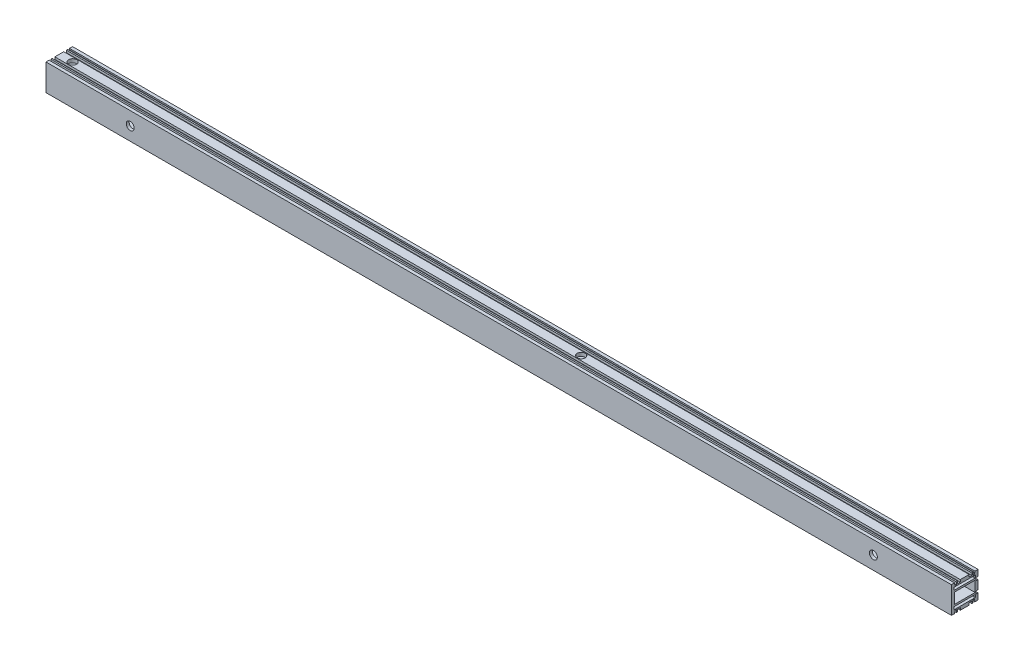
from build123d import *

# Parameters (mm, degrees)
SKETCH_1_W             = 23.5
SKETCH_1_H             = 12
EXTRUDE_1_DEPTH        = 510.5
HOLE_WIZARD_M6_1_D     = 5
HOLE_WIZARD_M6_1_DEPTH = 19
HOLE_WIZARD_M6_1_TIP   = 1.502151548
HOLE_WIZARD_M6_2_D     = 5
HOLE_WIZARD_M6_2_DEPTH = 19
HOLE_WIZARD_M6_2_TIP   = 1.502151548
SKETCH_6_R             = 4.5
CUT_EXTRUDE_1_DEPTH    = 512.600674355
SKETCH_7_R             = 4.5
CUT_EXTRUDE_2_DEPTH    = 512.600674355
HOLE_WIZARD_M4_1_D     = 3.3
HOLE_WIZARD_M4_1_DEPTH = 11.5
HOLE_WIZARD_M4_1_TIP   = 0.991420021


with BuildPart() as part:
    # 草图1 → 凸台-拉伸1 (new, symmetric)
    with BuildSketch(Plane(origin=(0, 0, 0), x_dir=(0, 0, -1), z_dir=(1, 0, 0))):
        Polygon((-11.5, 15), (-15, 15), (-15, -15), (-11.5, -15), (-11.5, -13.5), (-11, -13.5), (-11, -12), (-9.5, -12), (-9.5, -15), (-8, -15), (-8, -12.5), (-5, -12.5), (-5, -15), (5, -15), (5, -12.5), (8, -12.5), (8, -15), (9.5, -15), (9.5, -12), (11, -12), (11, -13.5), (11.5, -13.5), (11.5, -15), (15, -15), (15, -8), (12.5, -8), (12.5, -5), (15, -5), (15, 5), (12.5, 5), (12.5, 8), (15, 8), (15, 15), (11.5, 15), (11.5, 13.5), (11, 13.5), (11, 12), (9.5, 12), (9.5, 15), (8, 15), (8, 12.5), (5, 12.5), (5, 15), (-5, 15), (-5, 12.5), (-8, 12.5), (-8, 15), (-9.5, 15), (-9.5, 12), (-11, 12), (-11, 13.5), (-11.5, 13.5), align=None)
        with BuildLine():
            Line((12, -8.5), (12, -10.5))
            ThreePointArc((12, -10.5), (11.853553391, -10.853553391), (11.5, -11))
            Line((11.5, -11), (-11.5, -11))
            ThreePointArc((-11.5, -11), (-11.853553391, -10.853553391), (-12, -10.5))
            Line((-12, -10.5), (-12, -8.5))
            ThreePointArc((-12, -8.5), (-11.853553391, -8.146446609), (-11.5, -8))
            Line((-11.5, -8), (11.5, -8))
            ThreePointArc((11.5, -8), (11.853553391, -8.146446609), (12, -8.5))
        make_face(mode=Mode.SUBTRACT)
        Rectangle(SKETCH_1_W, SKETCH_1_H, mode=Mode.SUBTRACT)
        with BuildLine():
            ThreePointArc((-12, 10.5), (-11.853553391, 10.853553391), (-11.5, 11))
            Line((-11.5, 11), (11.5, 11))
            ThreePointArc((11.5, 11), (11.853553391, 10.853553391), (12, 10.5))
            Line((12, 10.5), (12, 8.5))
            ThreePointArc((12, 8.5), (11.853553391, 8.146446609), (11.5, 8))
            Line((11.5, 8), (-11.5, 8))
            ThreePointArc((-11.5, 8), (-11.853553391, 8.146446609), (-12, 8.5))
            Line((-12, 8.5), (-12, 10.5))
        make_face(mode=Mode.SUBTRACT)
    extrude(amount=EXTRUDE_1_DEPTH, both=True)

    # M6 螺纹孔1
    with Locations(Plane(origin=(0, -15, 0), x_dir=(-1, 0, 0), z_dir=(0, -1, 0))):
        with Locations((460.5, 0), (445.5, 0), (-133, 0), (-148, 0), (-218, 0), (-233, 0), (-445.5, 0), (-460.5, 0), (262.5, 0), (211.5, 0), (160.5, 0)):
            Hole(HOLE_WIZARD_M6_1_D / 2, depth=HOLE_WIZARD_M6_1_DEPTH)
            with Locations((0, 0, -(HOLE_WIZARD_M6_1_DEPTH + HOLE_WIZARD_M6_1_TIP / 2))):  # 118° drill point
                Cone(0, HOLE_WIZARD_M6_1_D / 2, HOLE_WIZARD_M6_1_TIP, mode=Mode.SUBTRACT)

    # M6 螺纹孔2
    with Locations(Plane(origin=(0, 0, -15), x_dir=(-1, 0, 0), z_dir=(0, 0, -1))):
        with Locations((460.5, 0), (445.5, 0), (157.5, 0), (142.5, 0), (-445.5, 0), (-460.5, 0)):
            Hole(HOLE_WIZARD_M6_2_D / 2, depth=HOLE_WIZARD_M6_2_DEPTH)
            with Locations((0, 0, -(HOLE_WIZARD_M6_2_DEPTH + HOLE_WIZARD_M6_2_TIP / 2))):  # 118° drill point
                Cone(0, HOLE_WIZARD_M6_2_D / 2, HOLE_WIZARD_M6_2_TIP, mode=Mode.SUBTRACT)

    # 草图6 → 切除-拉伸1 (cut, through all)
    with BuildSketch(Plane(origin=(0, 15, 0), x_dir=(1, 0, 0), z_dir=(0, 1, 0))):
        with Locations((-495.5, 0)):
            Circle(SKETCH_6_R)
        with Locations((78, 0)):
            Circle(SKETCH_6_R)
    extrude(amount=-CUT_EXTRUDE_1_DEPTH, mode=Mode.SUBTRACT)

    # 草图7 → 切除-拉伸2 (cut, through all)
    with BuildSketch(Plane.XY.offset(15)):
        with Locations((-415.5, 0)):
            Circle(SKETCH_7_R)
        with Locations((422.5, 0)):
            Circle(SKETCH_7_R)
    extrude(amount=-CUT_EXTRUDE_2_DEPTH, mode=Mode.SUBTRACT)

    # M4 螺纹孔1
    with Locations(Plane(origin=(0, 0, -15), x_dir=(-1, 0, 0), z_dir=(0, 0, -1))):
        with Locations((343.5, 0)):
            Hole(HOLE_WIZARD_M4_1_D / 2, depth=HOLE_WIZARD_M4_1_DEPTH)
            with Locations((0, 0, -(HOLE_WIZARD_M4_1_DEPTH + HOLE_WIZARD_M4_1_TIP / 2))):  # 118° drill point
                Cone(0, HOLE_WIZARD_M4_1_D / 2, HOLE_WIZARD_M4_1_TIP, mode=Mode.SUBTRACT)


solid = part.part
